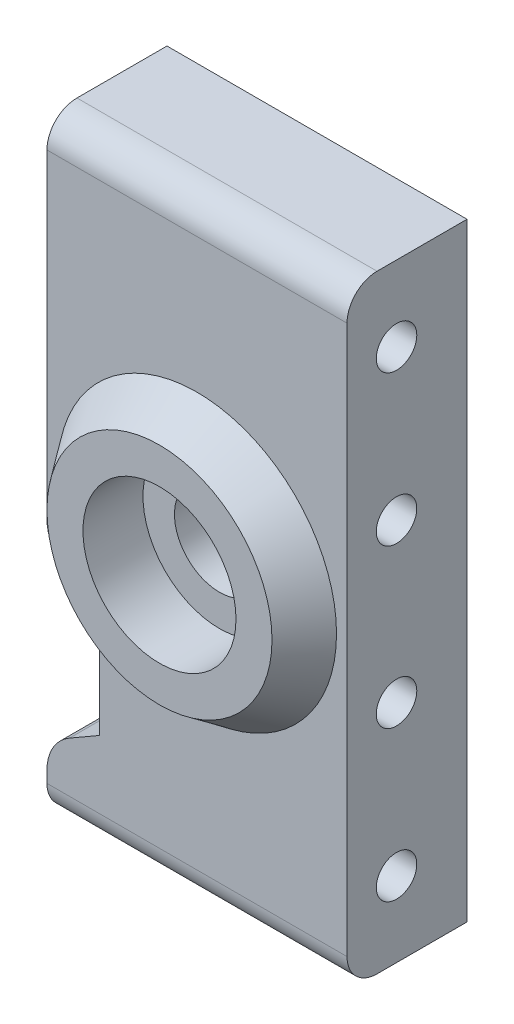
from build123d import *
from OCP.BRepFilletAPI import BRepFilletAPI_MakeChamfer

# Parameters (mm, degrees)
SKETCH1_W           = 20
SKETCH1_H           = 40.56076
BOSS_EXTRUDE1_DEPTH = 8
SKETCH6_R           = 1.35
CUT_EXTRUDE1_DEPTH  = 10
SKETCH8_R           = 7.5
BOSS_EXTRUDE2_DEPTH = 2.5
SKETCH9_R           = 5.1
CUT_EXTRUDE3_DEPTH  = 4
SKETCH10_R          = 3
CUT_EXTRUDE4_DEPTH  = 6.5
FILLET1_R           = 2
CHAMFER1_SIZE2      = 2.5
CHAMFER1_SIZE       = 1.8
SKETCH11_W          = 8
SKETCH11_H          = 7
CUT_EXTRUDE5_DEPTH  = 3.5
CHAMFER2_SIZE       = 2.020725942
CHAMFER2_SIZE_2     = 3.5
FILLET2_R           = 3


with BuildPart() as part:
    # Sketch1 → Boss-Extrude1 (new body)
    with BuildSketch(Plane.XY):
        Rectangle(SKETCH1_W, SKETCH1_H)
    extrude(amount=-BOSS_EXTRUDE1_DEPTH)

    # Sketch6 → Cut-Extrude1 (cut)
    with BuildSketch(Plane(origin=(10, 0, 0), x_dir=(0, 0, -1), z_dir=(1, 0, 0))):
        with Locations(Location((3.3, -15.26519, 0), (0, 0, 180))):
            Circle(SKETCH6_R)
        with Locations((3.3, -5.26519)):
            Circle(SKETCH6_R)
        with Locations((3.3, 15.26519)):
            Circle(SKETCH6_R)
        with Locations(Location((3.3, 5.26519, 0), (0, 0, 180))):
            Circle(SKETCH6_R)
    extrude(amount=-CUT_EXTRUDE1_DEPTH, mode=Mode.SUBTRACT)

    # Sketch8 → Boss-Extrude2 (add)
    with BuildSketch(Plane.XY):
        Circle(SKETCH8_R)
    extrude(amount=BOSS_EXTRUDE2_DEPTH)

    # Sketch9 → Cut-Extrude3 (cut)
    with BuildSketch(Plane.XY.offset(2.5)):
        Circle(SKETCH9_R)
    extrude(amount=-CUT_EXTRUDE3_DEPTH, mode=Mode.SUBTRACT)

    # Sketch10 → Cut-Extrude4 (cut)
    with BuildSketch(Plane.XY.offset(-1.5)):
        Circle(SKETCH10_R)
    extrude(amount=-CUT_EXTRUDE4_DEPTH, mode=Mode.SUBTRACT)

    # Fillet1
    fillet1_edges = [part.edges().sort_by_distance(p)[0] for p in [
        (0, -20.28038, 0),
        (0, 20.28038, 0),
    ]]
    fillet(fillet1_edges, radius=FILLET1_R)

    # Chamfer1
    chamfer1_edges = [part.edges().sort_by_distance(p)[0] for p in [
        (-7.5, 0, 0),
    ]]
    chamfer1_side = [part.faces().sort_by_distance(p)[0] for p in [
        (-7.536, 0, 0),
    ]]
    chamfer(chamfer1_edges, length=CHAMFER1_SIZE - 0.0001, length2=CHAMFER1_SIZE2 - 0.0001, reference=chamfer1_side[0])  # a hair under: the kernel refuses the full size

    # Sketch11 → Cut-Extrude5 (cut)
    with BuildSketch(Plane.ZY.offset(10)):
        with Locations((-4, -10.26517)):
            Rectangle(SKETCH11_W, SKETCH11_H)
    extrude(amount=-CUT_EXTRUDE5_DEPTH, mode=Mode.SUBTRACT)

    # Chamfer2
    chamfer2_edges_1 = [part.edges().sort_by_distance(p)[0] for p in [
        (-10, -13.76517, -4),
    ]]
    chamfer2_side_1 = [part.faces().sort_by_distance(p)[0] for p in [
        (-10, -13.805584519, -4),
    ]]
    chamfer2_edges_2 = [part.edges().sort_by_distance(p)[0] for p in [
        (-10, -6.76517, -4),
    ]]
    chamfer2_side_2 = [part.faces().sort_by_distance(p)[0] for p in [
        (-9.959585481, -6.76517, -4),
    ]]
    chamfer2 = BRepFilletAPI_MakeChamfer(part.part.solid().wrapped)
    for e in chamfer2_edges_1:
        chamfer2.Add(CHAMFER2_SIZE - 0.0001, CHAMFER2_SIZE_2 - 0.0001, e.wrapped, chamfer2_side_1[0].wrapped)
    for e in chamfer2_edges_2:
        chamfer2.Add(CHAMFER2_SIZE_2 - 0.0001, CHAMFER2_SIZE - 0.0001, e.wrapped, chamfer2_side_2[0].wrapped)
    add(Compound.cast(chamfer2.Shape()), mode=Mode.REPLACE)  # a hair under: the kernel refuses the full size

    # Fillet2
    fillet2_edges = [part.edges().sort_by_distance(p)[0] for p in [
        (-10, -15.785795942, -4),
        (-10, -4.744544058, -4),
    ]]
    fillet(fillet2_edges, radius=FILLET2_R)


solid = part.part
